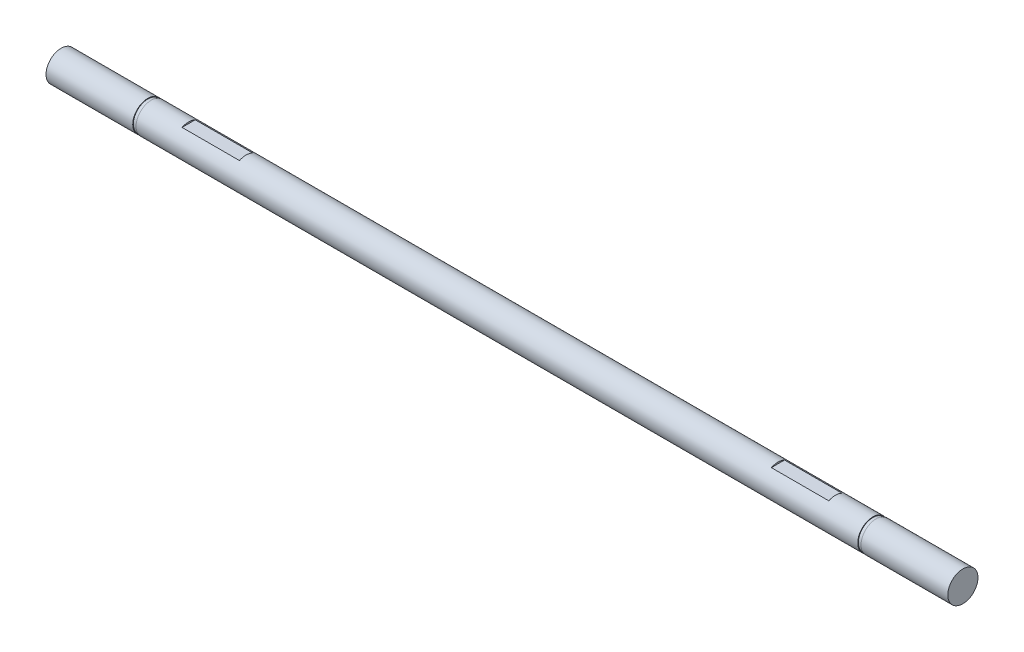
from build123d import *

# Parameters (mm, degrees)
EXTRUDE_1_DEPTH = 19
SKETCH_2_R      = 5
EXTRUDE_2_DEPTH = 16.2
SKETCH_5_W      = 1.1
SKETCH_5_H      = 0.2
EXTRUDE_START   = 176
SKETCH_4_R      = 5
EXTRUDE_4_DEPTH = 176
SKETCH_6_R      = 5
EXTRUDE_5_DEPTH = 26
EXTRUDE_START_2 = 26
SKETCH_7_R      = 5
EXTRUDE_6_DEPTH = 26


with BuildPart() as part:
    # 草图1 → 拉伸1 (new body)
    with BuildSketch(Plane(origin=(0, 0, 0), x_dir=(0, 0, -1), z_dir=(1, 0, 0))):
        with BuildLine():
            Line((-2.179449472, 4.5), (2.179449472, 4.5))
            ThreePointArc((2.179449472, 4.5), (0, -5), (-2.179449472, 4.5))
        make_face()
    extrude_1 = extrude(amount=EXTRUDE_1_DEPTH)

    # 草图2 → 拉伸2 (add)
    with BuildSketch(Plane(origin=(19, 0, 0), x_dir=(0, 0, -1), z_dir=(1, 0, 0))):
        Circle(SKETCH_2_R)
    extrude_2 = extrude(amount=EXTRUDE_2_DEPTH)

    # 草图5 → 切除-旋转1 (revolve, cut)
    with BuildSketch(Plane(origin=(0, 0, 0), x_dir=(1, 0, 0), z_dir=(0, 1, 0))):
        with Locations((31.95, 4.9)):
            Rectangle(SKETCH_5_W, SKETCH_5_H)
    cut_revolve_1 = revolve(axis=Axis((19, 0, 0), (-1, 0, 0)), mode=Mode.SUBTRACT)

    # 草图4 → 拉伸4 (add)
    with BuildSketch(Plane.ZY.offset(EXTRUDE_START)):
        Circle(SKETCH_4_R)
    extrude(amount=-EXTRUDE_4_DEPTH)

    # 镜向1: 拉伸1, 拉伸2, 切除-旋转1 across plane
    add(extrude_1.mirror(Plane.ZY.offset(88)))
    add(extrude_2.mirror(Plane.ZY.offset(88)))
    add(cut_revolve_1.mirror(Plane.ZY.offset(88)), mode=Mode.SUBTRACT)

    # 草图6 → 拉伸5 (add)
    with BuildSketch(Plane(origin=(35.2, 0, 0), x_dir=(0, 0, -1), z_dir=(1, 0, 0))):
        Circle(SKETCH_6_R)
    extrude(amount=EXTRUDE_5_DEPTH)

    # 草图7 → 拉伸6 (add)
    with BuildSketch(Plane.ZY.offset(211.2).offset(EXTRUDE_START_2)):
        Circle(SKETCH_7_R)
    extrude(amount=-EXTRUDE_6_DEPTH)


solid = part.part
